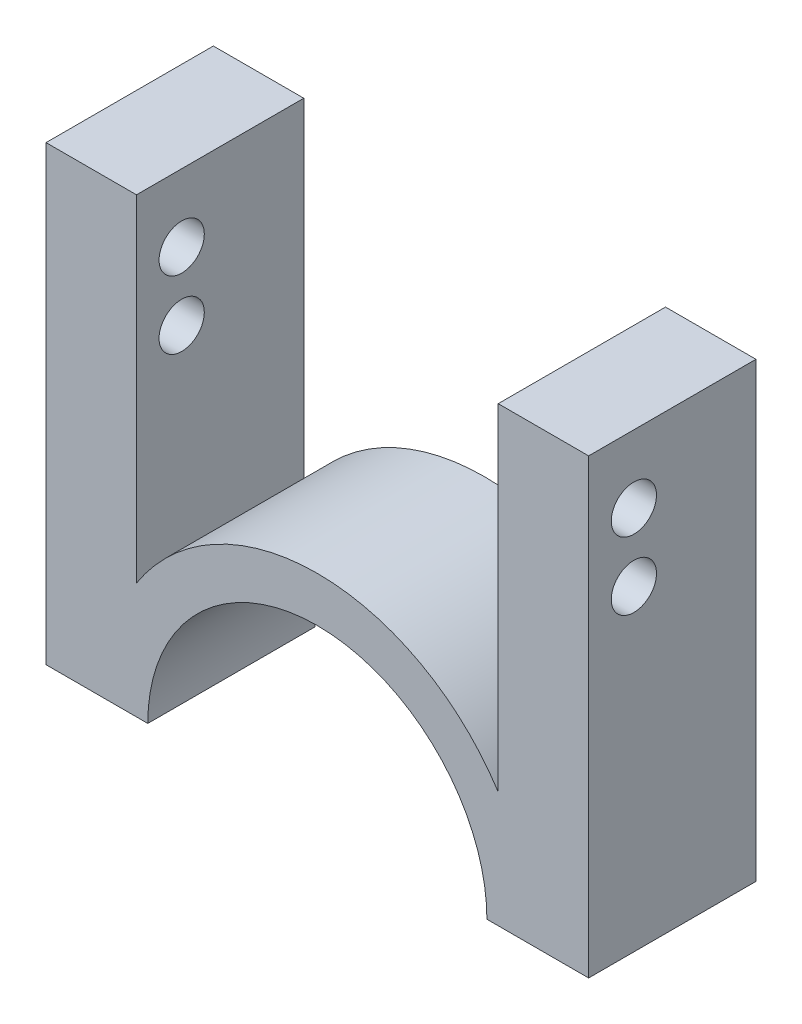
from build123d import *

# Parameters (mm, degrees)
DODANIE_WYCI_GNI_CIE1_DEPTH = 37
SZKIC2_R                    = 5
WYTNIJ_WYCI_GNI_CIE1_DEPTH  = 127


with BuildPart() as part:
    # Szkic1 → Dodanie-wyciągnięcie1 (new body)
    with BuildSketch(Plane.XY):
        with BuildLine():
            Line((37.5, 0), (47.5, 0))
            Line((47.5, 0), (60, 0))
            Line((60, 0), (60, 20))
            Line((60, 20), (60, 100))
            Line((60, 100), (40, 100))
            Line((40, 100), (40, 25.617376915))
            ThreePointArc((40, 25.617376915), (0, 47.5), (-40, 25.617376915))
            Line((-40, 25.617376915), (-40, 100))
            Line((-40, 100), (-60, 100))
            Line((-60, 100), (-60, 20))
            Line((-60, 20), (-60, 0))
            Line((-60, 0), (-47.5, 0))
            Line((-47.5, 0), (-37.5, 0))
            ThreePointArc((-37.5, 0), (0, 37.5), (37.5, 0))
        make_face()
    extrude(amount=DODANIE_WYCI_GNI_CIE1_DEPTH)

    # Szkic2 → Wytnij-wyciągnięcie1 (cut)
    with BuildSketch(Plane(origin=(60, 0, 0), x_dir=(0, 0, -1), z_dir=(1, 0, 0))):
        with Locations((-27, 85)):
            Circle(SZKIC2_R)
        with Locations((-27, 70)):
            Circle(SZKIC2_R)
    extrude(amount=-WYTNIJ_WYCI_GNI_CIE1_DEPTH, mode=Mode.SUBTRACT)


solid = part.part
